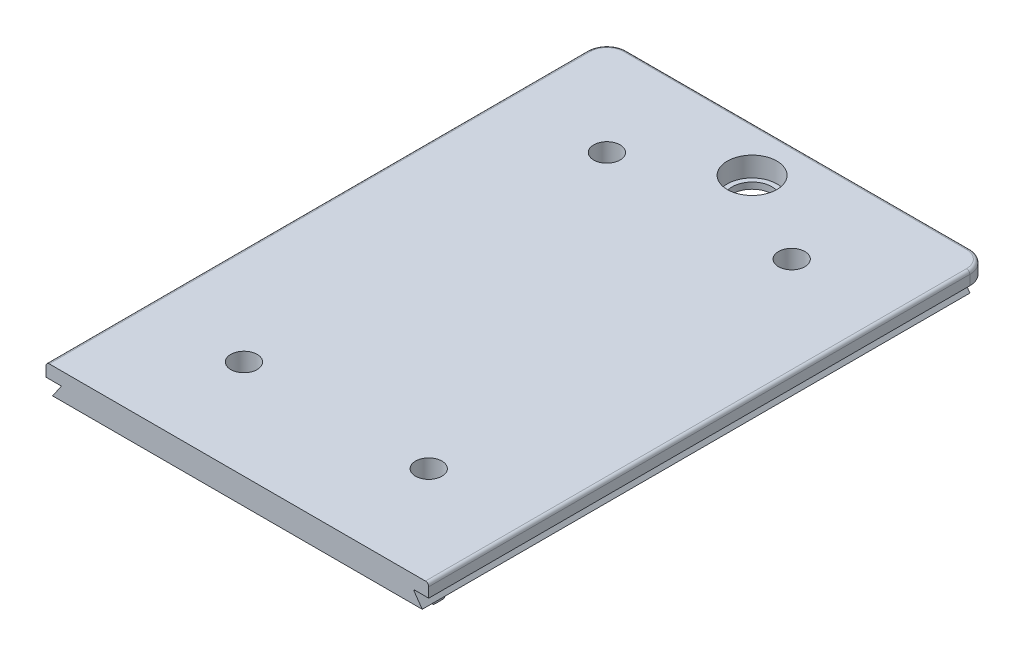
from build123d import *

# Parameters (mm, degrees)
BOSS_EXTRUDE1_DEPTH = 83
SKETCH3_W           = 58
SKETCH3_H           = 2
BOSS_EXTRUDE2_DEPTH = 2
FILLET1_R           = 3
SKETCH4_W           = 56.032437302
SKETCH4_H           = 2
BOSS_EXTRUDE3_DEPTH = 0.25
FILLET2_R           = 0.5
CUT_EXTRUDE1_REACH  = 91.909
SKETCH5_R           = 3
CUT_EXTRUDE2_REACH  = 91.909
SKETCH7_R           = 2
FILLET3_R           = 0.5
SKETCH8_R           = 3.75
CUT_EXTRUDE3_DEPTH  = 3


with BuildPart() as part:
    # Sketch1 → Boss-Extrude1 (new body)
    with BuildSketch(Plane.XY):
        Polygon((-26.755845082, 29), (-28.016218651, 27.2), (28.016218651, 27.2), (26.755845082, 29), (26.755845082, 29.15), (29, 29.15), (29, 31.15), (-29, 31.15), (-29, 29.15), (-26.755845082, 29.15), align=None)
    extrude(amount=-BOSS_EXTRUDE1_DEPTH)

    # Sketch3 → Boss-Extrude2 (add)
    with BuildSketch(Plane(origin=(0, 0, -83), x_dir=(-1, 0, 0), z_dir=(0, 0, -1))):
        with Locations((0, 30.15)):
            Rectangle(SKETCH3_W, SKETCH3_H)
    extrude(amount=BOSS_EXTRUDE2_DEPTH)

    # Fillet1
    fillet1_edges = [part.edges().sort_by_distance(p)[0] for p in [
        (-29, 30.15, -85),
        (29, 30.15, -85),
    ]]
    fillet(fillet1_edges, radius=FILLET1_R)

    # Sketch4 → Boss-Extrude3 (add)
    with BuildSketch(Plane.XZ.offset(-27.2)):
        with Locations((0, -2.5)):
            Rectangle(SKETCH4_W, SKETCH4_H)
    extrude(amount=BOSS_EXTRUDE3_DEPTH)

    # Fillet2
    # the kernel refuses this fillet: 0.5 mm, written as the material it takes off along each edge
    with BuildSketch(Plane(origin=(-29.098750406, 26.95, -3.5), x_dir=(0, 1, 0), z_dir=(1, 0, 0)), Plane(origin=(29.098750406, 26.95, -1.5), x_dir=(0, 1, 0), z_dir=(-1, 0, 0))) as fillet2_piece_1:
        with BuildLine():
            CenterArc((0.5, 0.433012702), FILLET2_R, 180, 60)
            Line((0, 0.433012702), (-0.01, 0.433012702))
            Line((-0.01, 0.433012702), (-0.01, 0))
            Line((-0.01, 0), (0, -0.01))
            ThreePointArc((0, -0.01), (0.125, -0.01), (0.245, -0.008660254))
            Line((0.245, -0.008660254), (0.25, 0))
        make_face()
    extrude(amount=58.197500812, mode=Mode.SUBTRACT)

    # Sketch5 → Cut-Extrude1 (cut, up to next)
    with BuildSketch(Plane(origin=(0, 31.15, 0), x_dir=(1, 0, 0), z_dir=(0, 1, 0)), mode=Mode.PRIVATE) as cut_extrude1_sk1:
        with Locations(Location((0, 78, 0), (0, 0, 270))):
            Circle(SKETCH5_R)
    cut_extrude1_tool1 = extrude(cut_extrude1_sk1.sketch, amount=-CUT_EXTRUDE1_REACH, mode=Mode.PRIVATE) & part.part
    add(cut_extrude1_tool1.solids().sort_by_distance((0, 31.15, -78))[0], mode=Mode.SUBTRACT)

    # Sketch7 → Cut-Extrude2 (cut, up to next)
    with BuildSketch(Plane(origin=(0, 31.15, 0), x_dir=(1, 0, 0), z_dir=(0, 1, 0)), mode=Mode.PRIVATE) as cut_extrude2_sk1:
        with Locations(Location((14, 15, 0), (0, 0, 270))):
            Circle(SKETCH7_R)
    cut_extrude2_tool1 = extrude(cut_extrude2_sk1.sketch, amount=-CUT_EXTRUDE2_REACH, mode=Mode.PRIVATE) & part.part
    # Sketch7 → Cut-Extrude2 (cut, up to next)
    with BuildSketch(Plane(origin=(0, 31.15, 0), x_dir=(1, 0, 0), z_dir=(0, 1, 0)), mode=Mode.PRIVATE) as cut_extrude2_sk2:
        with Locations((14, 70)):
            Circle(SKETCH7_R)
    cut_extrude2_tool2 = extrude(cut_extrude2_sk2.sketch, amount=-CUT_EXTRUDE2_REACH, mode=Mode.PRIVATE) & part.part
    # Sketch7 → Cut-Extrude2 (cut, up to next)
    with BuildSketch(Plane(origin=(0, 31.15, 0), x_dir=(1, 0, 0), z_dir=(0, 1, 0)), mode=Mode.PRIVATE) as cut_extrude2_sk3:
        with Locations(Location((-14, 70, 0), (0, 0, 270))):
            Circle(SKETCH7_R)
    cut_extrude2_tool3 = extrude(cut_extrude2_sk3.sketch, amount=-CUT_EXTRUDE2_REACH, mode=Mode.PRIVATE) & part.part
    # Sketch7 → Cut-Extrude2 (cut, up to next)
    with BuildSketch(Plane(origin=(0, 31.15, 0), x_dir=(1, 0, 0), z_dir=(0, 1, 0)), mode=Mode.PRIVATE) as cut_extrude2_sk4:
        with Locations((-14, 15)):
            Circle(SKETCH7_R)
    cut_extrude2_tool4 = extrude(cut_extrude2_sk4.sketch, amount=-CUT_EXTRUDE2_REACH, mode=Mode.PRIVATE) & part.part
    add(cut_extrude2_tool1.solids().sort_by_distance((14, 31.15, -15))[0], mode=Mode.SUBTRACT)
    add(cut_extrude2_tool2.solids().sort_by_distance((14, 31.15, -70))[0], mode=Mode.SUBTRACT)
    add(cut_extrude2_tool3.solids().sort_by_distance((-14, 31.15, -70))[0], mode=Mode.SUBTRACT)
    add(cut_extrude2_tool4.solids().sort_by_distance((-14, 31.15, -15))[0], mode=Mode.SUBTRACT)

    # Fillet3
    fillet3_edges = [part.edges().sort_by_distance(p)[0] for p in [
        (29, 31.15, -41),
        (0, 31.15, -85),
        (-29, 31.15, -41),
        (-28.121320344, 31.15, -84.121320344),
        (28.121320344, 31.15, -84.121320344),
    ]]
    fillet(fillet3_edges, radius=FILLET3_R)

    # Sketch8 → Cut-Extrude3 (cut)
    with BuildSketch(Plane(origin=(0, 31.15, 0), x_dir=(1, 0, 0), z_dir=(0, 1, 0))):
        with Locations(Location((0, 78, 0), (0, 0, 270))):
            Circle(SKETCH8_R)
    extrude(amount=-CUT_EXTRUDE3_DEPTH, mode=Mode.SUBTRACT)


solid = part.part
